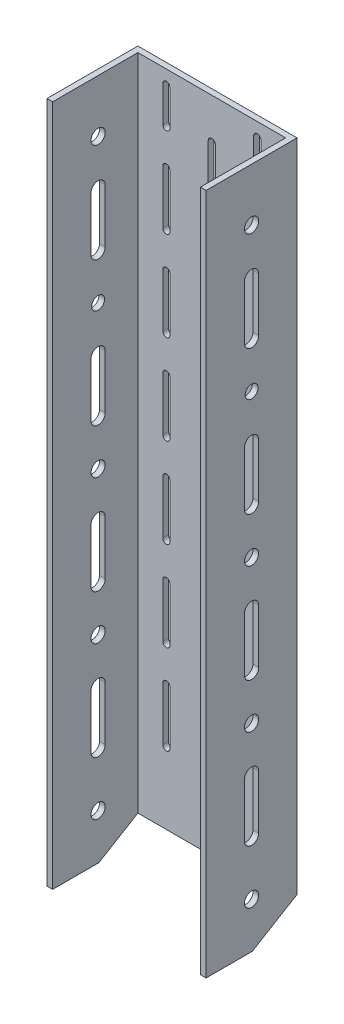
from build123d import *

# Parameters (mm, degrees)
BOSS_EXTRUDE1_DEPTH = 190.5
SKETCH3_R           = 3.96875
CUT_EXTRUDE1_DEPTH  = 381
CUT_EXTRUDE2_DEPTH  = 381
SKETCH5_R           = 3.92206945
SKETCH5_R_2         = 3.96875
SKETCH5_R_3         = 3.58576203
CUT_EXTRUDE3_DEPTH  = 381
CHAMFER1_SIZE       = 25
CHAMFER1_SIZE_2     = 15
CUT_EXTRUDE4_DEPTH  = 10


with BuildPart() as part:
    # Sketch1 → Boss-Extrude1 (new, symmetric)
    with BuildSketch(Plane(origin=(0, 0, 0), x_dir=(1, 0, 0), z_dir=(0, 1, 0))):
        Polygon((-41.275, 22.225), (-41.275, -25.4), (-44.45, -25.4), (-44.45, 25.4), (44.45, 25.4), (44.45, -25.4), (41.275, -25.4), (41.275, 22.225), align=None)
    extrude(amount=BOSS_EXTRUDE1_DEPTH, both=True)

    # Sketch3 → Cut-Extrude1 (cut)
    with BuildSketch(Plane(origin=(44.45, 0, 0), x_dir=(0, 0, -1), z_dir=(1, 0, 0))):
        with Locations((0, -165.1)):
            Circle(SKETCH3_R)
    extrude(amount=-CUT_EXTRUDE1_DEPTH, mode=Mode.SUBTRACT)

    # Sketch4 → Cut-Extrude2 (cut)
    with BuildSketch(Plane(origin=(44.45, 0, 0), x_dir=(0, 0, -1), z_dir=(1, 0, 0))):
        with BuildLine():
            Line((-3.96875, -135.1), (-3.96875, -105.1))
            ThreePointArc((-3.96875, -105.1), (0, -101.13125), (3.96875, -105.1))
            Line((3.96875, -105.1), (3.96875, -135.1))
            ThreePointArc((3.96875, -135.1), (0, -139.06875), (-3.96875, -135.1))
        make_face()
        with BuildLine():
            Line((-3.96875, -54.85), (-3.96875, -24.85))
            ThreePointArc((-3.96875, -24.85), (0, -20.88125), (3.96875, -24.85))
            Line((3.96875, -24.85), (3.96875, -54.85))
            ThreePointArc((3.96875, -54.85), (0, -58.81875), (-3.96875, -54.85))
        make_face()
        with BuildLine():
            Line((-3.96875, 25.4), (-3.96875, 55.4))
            ThreePointArc((-3.96875, 55.4), (0, 59.36875), (3.96875, 55.4))
            Line((3.96875, 55.4), (3.96875, 25.4))
            ThreePointArc((3.96875, 25.4), (0, 21.43125), (-3.96875, 25.4))
        make_face()
        with BuildLine():
            Line((-3.96875, 105.65), (-3.96875, 135.65))
            ThreePointArc((-3.96875, 135.65), (0, 139.61875), (3.96875, 135.65))
            Line((3.96875, 135.65), (3.96875, 105.65))
            ThreePointArc((3.96875, 105.65), (0, 101.68125), (-3.96875, 105.65))
        make_face()
    extrude(amount=-CUT_EXTRUDE2_DEPTH, mode=Mode.SUBTRACT)

    # Sketch5 → Cut-Extrude3 (cut)
    with BuildSketch(Plane(origin=(44.45, 0, 0), x_dir=(0, 0, -1), z_dir=(1, 0, 0))):
        with Locations((0, 0.275)):
            Circle(SKETCH5_R)
        with Locations((0, -79.975)):
            Circle(SKETCH5_R_2)
        with Locations((0, 80.525)):
            Circle(SKETCH5_R_3)
        with Locations((0, 161.05)):
            Circle(SKETCH5_R_2)
    extrude(amount=-CUT_EXTRUDE3_DEPTH, mode=Mode.SUBTRACT)

    # Chamfer1
    # the kernel refuses this chamfer: 25, 15 mm, written as the material it takes off along each edge
    with BuildSketch(Plane(origin=(-109.10652743, -190.5, -25.4), x_dir=(0, -0.01989341895858275, 0.9998021063601229), z_dir=(1, 0, 0))) as chamfer1_piece_1:
        Polygon((CHAMFER1_SIZE * 0.99980210636, -CHAMFER1_SIZE * 0.0198934189586), (-CHAMFER1_SIZE_2 * 0.0198934189586, -CHAMFER1_SIZE_2 * 0.99980210636), (0, 0), align=None)
    extrude(amount=218.21305486, mode=Mode.SUBTRACT)

    # Sketch6 → Cut-Extrude4 (cut)
    with BuildSketch(Plane(origin=(0, 0, -25.4), x_dir=(-1, 0, 0), z_dir=(0, 0, -1))):
        with BuildLine():
            Line((-1.984375, -162.405), (-1.984375, -132.405))
            ThreePointArc((-1.984375, -132.405), (0, -130.420625), (1.984375, -132.405))
            Line((1.984375, -132.405), (1.984375, -162.405))
            ThreePointArc((1.984375, -162.405), (0, -164.389375), (-1.984375, -162.405))
        make_face()
        with BuildLine():
            Line((-1.984375, -112.405), (-1.984375, -82.405))
            ThreePointArc((-1.984375, -82.405), (0, -80.420625), (1.984375, -82.405))
            Line((1.984375, -82.405), (1.984375, -112.405))
            ThreePointArc((1.984375, -112.405), (0, -114.389375), (-1.984375, -112.405))
        make_face()
        with BuildLine():
            Line((-1.984375, -62.405), (-1.984375, -32.405))
            ThreePointArc((-1.984375, -32.405), (0, -30.420625), (1.984375, -32.405))
            Line((1.984375, -32.405), (1.984375, -62.405))
            ThreePointArc((1.984375, -62.405), (0, -64.389375), (-1.984375, -62.405))
        make_face()
        with BuildLine():
            Line((-2.373609799, -12.405), (-2.373609799, 17.595))
            ThreePointArc((-2.373609799, 17.595), (0, 19.968609799), (2.373609799, 17.595))
            Line((2.373609799, 17.595), (2.373609799, -12.405))
            ThreePointArc((2.373609799, -12.405), (0, -14.778609799), (-2.373609799, -12.405))
        make_face()
        with BuildLine():
            Line((-1.984375, 37.595), (-1.984375, 67.595))
            ThreePointArc((-1.984375, 67.595), (0, 69.579375), (1.984375, 67.595))
            Line((1.984375, 67.595), (1.984375, 37.595))
            ThreePointArc((1.984375, 37.595), (0, 35.610625), (-1.984375, 37.595))
        make_face()
        with BuildLine():
            Line((-1.984375, 87.595), (-1.984375, 117.595))
            ThreePointArc((-1.984375, 117.595), (0, 119.579375), (1.984375, 117.595))
            Line((1.984375, 117.595), (1.984375, 87.595))
            ThreePointArc((1.984375, 87.595), (0, 85.610625), (-1.984375, 87.595))
        make_face()
        with BuildLine():
            Line((-1.984375, 137.595), (-1.984375, 167.595))
            ThreePointArc((-1.984375, 167.595), (0, 169.579375), (1.984375, 167.595))
            Line((1.984375, 167.595), (1.984375, 137.595))
            ThreePointArc((1.984375, 137.595), (0, 135.610625), (-1.984375, 137.595))
        make_face()
        with BuildLine():
            Line((23.415625, -137.405), (23.415625, -107.405))
            ThreePointArc((23.415625, -107.405), (25.4, -105.420625), (27.384375, -107.405))
            Line((27.384375, -107.405), (27.384375, -137.405))
            ThreePointArc((27.384375, -137.405), (25.4, -139.389375), (23.415625, -137.405))
        make_face()
        with BuildLine():
            Line((23.415625, -87.405), (23.415625, -57.405))
            ThreePointArc((23.415625, -57.405), (25.4, -55.420625), (27.384375, -57.405))
            Line((27.384375, -57.405), (27.384375, -87.405))
            ThreePointArc((27.384375, -87.405), (25.4, -89.389375), (23.415625, -87.405))
        make_face()
        with BuildLine():
            Line((23.415625, -37.405), (23.415625, -7.405))
            ThreePointArc((23.415625, -7.405), (25.4, -5.420625), (27.384375, -7.405))
            Line((27.384375, -7.405), (27.384375, -37.405))
            ThreePointArc((27.384375, -37.405), (25.4, -39.389375), (23.415625, -37.405))
        make_face()
        with BuildLine():
            Line((23.415625, 12.595), (23.415625, 42.595))
            ThreePointArc((23.415625, 42.595), (25.4, 44.579375), (27.384375, 42.595))
            Line((27.384375, 42.595), (27.384375, 12.595))
            ThreePointArc((27.384375, 12.595), (25.4, 10.610625), (23.415625, 12.595))
        make_face()
        with BuildLine():
            Line((23.415625, 62.595), (23.415625, 92.595))
            ThreePointArc((23.415625, 92.595), (25.4, 94.579375), (27.384375, 92.595))
            Line((27.384375, 92.595), (27.384375, 62.595))
            ThreePointArc((27.384375, 62.595), (25.4, 60.610625), (23.415625, 62.595))
        make_face()
        with BuildLine():
            Line((23.415625, 112.595), (23.415625, 142.595))
            ThreePointArc((23.415625, 142.595), (25.4, 144.579375), (27.384375, 142.595))
            Line((27.384375, 142.595), (27.384375, 112.595))
            ThreePointArc((27.384375, 112.595), (25.4, 110.610625), (23.415625, 112.595))
        make_face()
        with BuildLine():
            Line((23.415625, 162.595), (23.415625, 182.595))
            ThreePointArc((23.415625, 182.595), (25.4, 184.579375), (27.384375, 182.595))
            Line((27.384375, 182.595), (27.384375, 162.595))
            ThreePointArc((27.384375, 162.595), (25.4, 160.610625), (23.415625, 162.595))
        make_face()
        with BuildLine():
            Line((-23.415625, -137.405), (-23.415625, -107.405))
            ThreePointArc((-23.415625, -107.405), (-25.4, -105.420625), (-27.384375, -107.405))
            Line((-27.384375, -107.405), (-27.384375, -137.405))
            ThreePointArc((-27.384375, -137.405), (-25.4, -139.389375), (-23.415625, -137.405))
        make_face()
        with BuildLine():
            Line((-23.415625, -87.405), (-23.415625, -57.405))
            ThreePointArc((-23.415625, -57.405), (-25.4, -55.420625), (-27.384375, -57.405))
            Line((-27.384375, -57.405), (-27.384375, -87.405))
            ThreePointArc((-27.384375, -87.405), (-25.4, -89.389375), (-23.415625, -87.405))
        make_face()
        with BuildLine():
            Line((-23.415625, -37.405), (-23.415625, -7.405))
            ThreePointArc((-23.415625, -7.405), (-25.4, -5.420625), (-27.384375, -7.405))
            Line((-27.384375, -7.405), (-27.384375, -37.405))
            ThreePointArc((-27.384375, -37.405), (-25.4, -39.389375), (-23.415625, -37.405))
        make_face()
        with BuildLine():
            Line((-23.415625, 12.595), (-23.415625, 42.595))
            ThreePointArc((-23.415625, 42.595), (-25.4, 44.579375), (-27.384375, 42.595))
            Line((-27.384375, 42.595), (-27.384375, 12.595))
            ThreePointArc((-27.384375, 12.595), (-25.4, 10.610625), (-23.415625, 12.595))
        make_face()
        with BuildLine():
            Line((-23.415625, 62.595), (-23.415625, 92.595))
            ThreePointArc((-23.415625, 92.595), (-25.4, 94.579375), (-27.384375, 92.595))
            Line((-27.384375, 92.595), (-27.384375, 62.595))
            ThreePointArc((-27.384375, 62.595), (-25.4, 60.610625), (-23.415625, 62.595))
        make_face()
        with BuildLine():
            Line((-23.415625, 112.595), (-23.415625, 142.595))
            ThreePointArc((-23.415625, 142.595), (-25.4, 144.579375), (-27.384375, 142.595))
            Line((-27.384375, 142.595), (-27.384375, 112.595))
            ThreePointArc((-27.384375, 112.595), (-25.4, 110.610625), (-23.415625, 112.595))
        make_face()
        with BuildLine():
            Line((-23.415625, 162.595), (-23.415625, 182.595))
            ThreePointArc((-23.415625, 182.595), (-25.4, 184.579375), (-27.384375, 182.595))
            Line((-27.384375, 182.595), (-27.384375, 162.595))
            ThreePointArc((-27.384375, 162.595), (-25.4, 160.610625), (-23.415625, 162.595))
        make_face()
    extrude(amount=-CUT_EXTRUDE4_DEPTH, mode=Mode.SUBTRACT)


solid = part.part
